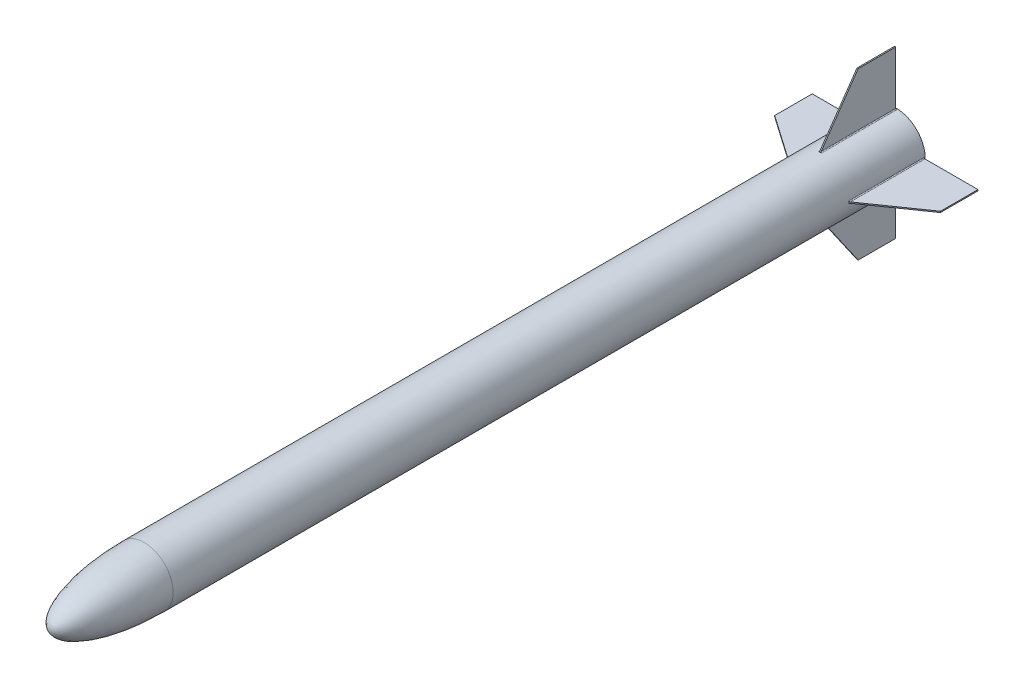
from build123d import *

# Parameters (mm, degrees)
SKETCH3_R                = 43.942
BOSS_EXTRUDE1_DEPTH      = 15.24
BOSS_EXTRUDE2_REACH      = 2331.885
BOSS_EXTRUDE2_END_RADIUS = 78.322932
SKETCH4_W                = 3.175
SKETCH4_H                = 203.2
CUT_EXTRUDE1_REACH       = 2322.063
FILLET1_R                = 2.54
CIRPATTERN1_COUNT        = 4
FILLET1_OF_CIRPATTERN1_R = 2.54


with BuildPart() as part:
    # Sketch2 → Revolve1 (revolve)
    with BuildSketch(Plane(origin=(0, 0, 0), x_dir=(0, 0, -1), z_dir=(1, 0, 0)), mode=Mode.PRIVATE) as revolve1_sk:
        with BuildLine():
            Line((254, 78.322932), (2289.4925, 78.322932))
            Line((2289.4925, 78.322932), (2289.4925, 0))
            Line((2289.4925, 0), (0, 0))
            add(Edge.make_bspline(
                [(254, 78.322932), (0, 78.322932), (0, 0)],
                knots=[4.71238898, 4.71238898, 4.71238898, 6.283185307, 6.283185307, 6.283185307], degree=2, weights=[1, 0.707106781, 1]))
        make_face()
    revolve(revolve1_sk.sketch.rotate(Axis((0, 0, -2289.4925), (0, 0, 1)), 90), axis=Axis((0, 0, -2289.4925), (0, 0, 1)))

    # Sketch3 → Boss-Extrude1 (add)
    with BuildSketch(Plane(origin=(0, 0, -2289.4925), x_dir=(-1, 0, 0), z_dir=(0, 0, -1))):
        with Locations(Location((0, 0, 0), (0, 0, 270))):
            Circle(SKETCH3_R)
    extrude(amount=BOSS_EXTRUDE1_DEPTH)

    # Boss-Extrude2: up to this cylinder (the profile starts outside it)
    boss_extrude2_end = Plane(origin=(0, 0, -2184.7175), z_dir=(0, 0, -1)) * Cylinder(BOSS_EXTRUDE2_END_RADIUS, 4821.415864, mode=Mode.PRIVATE)
    # Sketch4 → Boss-Extrude2 (add, up to the surface)
    with BuildSketch(Plane(origin=(0, 254, 0), x_dir=(1, 0, 0), z_dir=(0, 1, 0)), mode=Mode.PRIVATE) as boss_extrude2_sk1:
        with Locations((0, 2184.7175)):
            Rectangle(SKETCH4_W, SKETCH4_H)
    boss_extrude2_tool1 = extrude(boss_extrude2_sk1.sketch, amount=-BOSS_EXTRUDE2_REACH, mode=Mode.PRIVATE) - boss_extrude2_end
    boss_extrude2 = boss_extrude2_tool1.solids().sort_by_distance((0, 254, -2184.7175))[0]
    add(boss_extrude2)

    # Sketch5 → Cut-Extrude1 (cut, up to next)
    with BuildSketch(Plane.ZY.offset(1.5875), mode=Mode.PRIVATE) as cut_extrude1_sk1:
        Polygon((-2286.3175, 224.356842107), (-2184.7175, 224.356842107), (-2083.1175, 78.306842107), (-2083.1175, 254), (-2286.3175, 254), align=None)
    cut_extrude1_tool1 = extrude(cut_extrude1_sk1.sketch, amount=-CUT_EXTRUDE1_REACH, mode=Mode.PRIVATE) & part.part
    cut_extrude1 = cut_extrude1_tool1.solids().sort_by_distance((-1.5875, 204.128915, -2147.334252))[0]
    add(cut_extrude1, mode=Mode.SUBTRACT)

    # Fillet1
    # the kernel refuses this fillet: 2.54 mm, written as the material it adds along each edge
    with BuildSketch(Plane(origin=(-1.5875, 78.306842107, -2076.990797857), x_dir=(-0.9993639751499004, -0.03566013422001241, 0), z_dir=(0, 0, -1))) as fillet1_piece_1_section:
        with BuildLine():
            CenterArc((2.450992889, 2.539698904), FILLET1_R, 182.043608468, 87.074170625)
            Line((-0.087391608, 2.449122163), (0, 0))
            ThreePointArc((0, 0), (1.205942189, 0.009284527), (2.411884379, 0))
        make_face()
    fillet1_piece_1 = extrude(amount=209.326702143, mode=Mode.PRIVATE)
    fillet1_piece_1 = split(fillet1_piece_1, bisect_by=Plane(origin=(-3.095055571, 78.248638535, -2083.077010558), z_dir=(0, -0.5710644881985995, -0.8209052017854874)), keep=Keep.TOP, mode=Mode.PRIVATE)
    add(fillet1_piece_1)
    with BuildSketch(Plane(origin=(1.5875, 78.306842107, -2076.990797857), x_dir=(0.9993639751499004, -0.035660134220013434, 0), z_dir=(0, 0, -1))) as fillet1_piece_2_section:
        with BuildLine():
            CenterArc((2.450992889, -2.539698904), FILLET1_R, 90.882220907, 87.074170625)
            Line((-0.087391608, -2.449122163), (0, 0))
            ThreePointArc((0, 0), (1.205942189, -0.009284527), (2.411884379, 0))
        make_face()
    fillet1_piece_2 = extrude(amount=209.326702143, mode=Mode.PRIVATE)
    fillet1_piece_2 = split(fillet1_piece_2, bisect_by=Plane(origin=(3.095055571, 78.248638535, -2083.077010558), z_dir=(0, -0.5710644881985995, -0.8209052017854874)), keep=Keep.TOP, mode=Mode.PRIVATE)
    add(fillet1_piece_2)

    # CirPattern1: Boss-Extrude2, Cut-Extrude1 ×4 about axis
    cirpattern1_axis = Axis((0, 0, 0), (0, 0, 1))
    add([boss_extrude2.rotate(cirpattern1_axis, i * 360 / CIRPATTERN1_COUNT) for i in range(1, CIRPATTERN1_COUNT)])
    add([cut_extrude1.rotate(cirpattern1_axis, i * 360 / CIRPATTERN1_COUNT) for i in range(1, CIRPATTERN1_COUNT)], mode=Mode.SUBTRACT)

    # Fillet1 of CirPattern1
    # the kernel refuses this fillet: 2.54 mm, written as the material it adds along each edge
    with BuildSketch(Plane(origin=(-78.306842107, -1.5875, -2076.990797857), x_dir=(0.035660134220018486, -0.9993639751499002, 0), z_dir=(0, 0, -1))) as fillet1_of_cirpattern1_piece_1_section:
        with BuildLine():
            CenterArc((2.450992889, 2.539698904), FILLET1_OF_CIRPATTERN1_R, 182.043608468, 87.074170625)
            Line((-0.087391608, 2.449122163), (0, 0))
            ThreePointArc((0, 0), (1.205942189, 0.009284527), (2.411884379, 0))
        make_face()
    fillet1_of_cirpattern1_piece_1 = extrude(amount=209.326702143, mode=Mode.PRIVATE)
    fillet1_of_cirpattern1_piece_1 = split(fillet1_of_cirpattern1_piece_1, bisect_by=Plane(origin=(-78.248638535, -3.095055571, -2083.077010558), z_dir=(0.5710644881985995, 0, -0.8209052017854874)), keep=Keep.TOP, mode=Mode.PRIVATE)
    add(fillet1_of_cirpattern1_piece_1)
    with BuildSketch(Plane(origin=(-78.306842107, 1.5875, -2076.990797857), x_dir=(0.03566013422001241, 0.9993639751499004, 0), z_dir=(0, 0, -1))) as fillet1_of_cirpattern1_piece_2_section:
        with BuildLine():
            CenterArc((2.450992889, -2.539698904), FILLET1_OF_CIRPATTERN1_R, 90.882220907, 87.074170625)
            Line((-0.087391608, -2.449122163), (0, 0))
            ThreePointArc((0, 0), (1.205942189, -0.009284527), (2.411884379, 0))
        make_face()
    fillet1_of_cirpattern1_piece_2 = extrude(amount=209.326702143, mode=Mode.PRIVATE)
    fillet1_of_cirpattern1_piece_2 = split(fillet1_of_cirpattern1_piece_2, bisect_by=Plane(origin=(-78.248638535, 3.095055571, -2083.077010558), z_dir=(0.5710644881985995, 0, -0.8209052017854874)), keep=Keep.TOP, mode=Mode.PRIVATE)
    add(fillet1_of_cirpattern1_piece_2)
    with BuildSketch(Plane(origin=(1.5875, -78.306842107, -2076.990797857), x_dir=(0.9993639751499002, 0.035660134220018555, 0), z_dir=(0, 0, -1))) as fillet1_of_cirpattern1_piece_3_section:
        with BuildLine():
            CenterArc((2.450992889, 2.539698904), FILLET1_OF_CIRPATTERN1_R, 182.043608468, 87.074170625)
            Line((-0.087391608, 2.449122163), (0, 0))
            ThreePointArc((0, 0), (1.205942189, 0.009284527), (2.411884379, 0))
        make_face()
    fillet1_of_cirpattern1_piece_3 = extrude(amount=209.326702143, mode=Mode.PRIVATE)
    fillet1_of_cirpattern1_piece_3 = split(fillet1_of_cirpattern1_piece_3, bisect_by=Plane(origin=(3.095055571, -78.248638535, -2083.077010558), z_dir=(0, 0.5710644881985995, -0.8209052017854874)), keep=Keep.TOP, mode=Mode.PRIVATE)
    add(fillet1_of_cirpattern1_piece_3)
    with BuildSketch(Plane(origin=(-1.5875, -78.306842107, -2076.990797857), x_dir=(-0.9993639751499004, 0.03566013422001239, 0), z_dir=(0, 0, -1))) as fillet1_of_cirpattern1_piece_4_section:
        with BuildLine():
            CenterArc((2.450992889, -2.539698904), FILLET1_OF_CIRPATTERN1_R, 90.882220907, 87.074170625)
            Line((-0.087391608, -2.449122163), (0, 0))
            ThreePointArc((0, 0), (1.205942189, -0.009284527), (2.411884379, 0))
        make_face()
    fillet1_of_cirpattern1_piece_4 = extrude(amount=209.326702143, mode=Mode.PRIVATE)
    fillet1_of_cirpattern1_piece_4 = split(fillet1_of_cirpattern1_piece_4, bisect_by=Plane(origin=(-3.095055571, -78.248638535, -2083.077010558), z_dir=(0, 0.5710644881985995, -0.8209052017854874)), keep=Keep.TOP, mode=Mode.PRIVATE)
    add(fillet1_of_cirpattern1_piece_4)
    with BuildSketch(Plane(origin=(78.306842107, 1.5875, -2076.990797857), x_dir=(-0.03566013422001241, 0.9993639751499004, 0), z_dir=(0, 0, -1))) as fillet1_of_cirpattern1_piece_5_section:
        with BuildLine():
            CenterArc((2.450992889, 2.539698904), FILLET1_OF_CIRPATTERN1_R, 182.043608468, 87.074170625)
            Line((-0.087391608, 2.449122163), (0, 0))
            ThreePointArc((0, 0), (1.205942189, 0.009284527), (2.411884379, 0))
        make_face()
    fillet1_of_cirpattern1_piece_5 = extrude(amount=209.326702143, mode=Mode.PRIVATE)
    fillet1_of_cirpattern1_piece_5 = split(fillet1_of_cirpattern1_piece_5, bisect_by=Plane(origin=(78.248638535, 3.095055571, -2083.077010558), z_dir=(-0.5710644881985995, 0, -0.8209052017854874)), keep=Keep.TOP, mode=Mode.PRIVATE)
    add(fillet1_of_cirpattern1_piece_5)
    with BuildSketch(Plane(origin=(78.306842107, -1.5875, -2076.990797857), x_dir=(-0.03566013422001239, -0.9993639751499004, 0), z_dir=(0, 0, -1))) as fillet1_of_cirpattern1_piece_6_section:
        with BuildLine():
            CenterArc((2.450992889, -2.539698904), FILLET1_OF_CIRPATTERN1_R, 90.882220907, 87.074170625)
            Line((-0.087391608, -2.449122163), (0, 0))
            ThreePointArc((0, 0), (1.205942189, -0.009284527), (2.411884379, 0))
        make_face()
    fillet1_of_cirpattern1_piece_6 = extrude(amount=209.326702143, mode=Mode.PRIVATE)
    fillet1_of_cirpattern1_piece_6 = split(fillet1_of_cirpattern1_piece_6, bisect_by=Plane(origin=(78.248638535, -3.095055571, -2083.077010558), z_dir=(-0.5710644881985995, 0, -0.8209052017854874)), keep=Keep.TOP, mode=Mode.PRIVATE)
    add(fillet1_of_cirpattern1_piece_6)


solid = part.part
